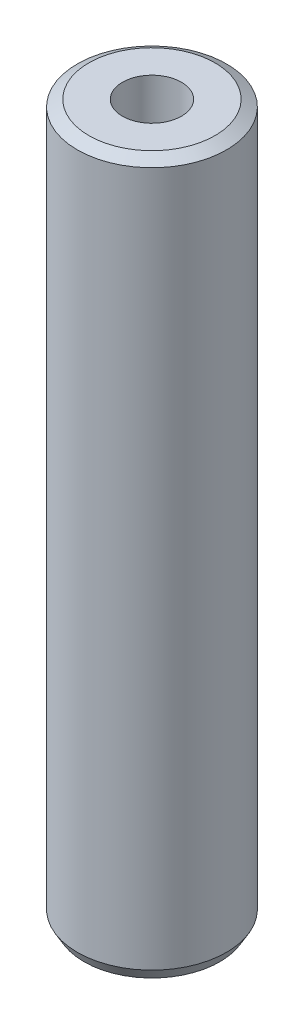
from build123d import *
from OCP.BRepFilletAPI import BRepFilletAPI_MakeChamfer

# Parameters (mm, degrees)
SKETCH1_R           = 50
BOSS_EXTRUDE1_DEPTH = 478.131743215
SKETCH2_R           = 19.774849794
CUT_EXTRUDE1_DEPTH  = 484.33214653
CHAMFER1_SIZE       = 4.447933979
CHAMFER1_SIZE2      = 7.70404764


with BuildPart() as part:
    # Sketch1 → Boss-Extrude1 (new body)
    with BuildSketch(Plane(origin=(0, 0, 0), x_dir=(1, 0, 0), z_dir=(0, 1, 0))):
        Circle(SKETCH1_R)
    extrude(amount=BOSS_EXTRUDE1_DEPTH)

    # Sketch2 → Cut-Extrude1 (cut, through all)
    with BuildSketch(Plane(origin=(0, 0, 0), x_dir=(1, 0, 0), z_dir=(0, 1, 0))):
        Circle(SKETCH2_R)
    extrude(amount=CUT_EXTRUDE1_DEPTH, mode=Mode.SUBTRACT)

    # Chamfer1: one chamfer whose edges measure the first distance from different faces: ONE call of the kernel's chamfer builder (chamfer() names one face for all edges)
    chamfer1_edges_1 = [part.edges().sort_by_distance(p)[0] for p in [
        (-50, 478.131743215, 0),
    ]]
    chamfer1_side_1 = [part.faces().sort_by_distance(p)[0] for p in [
        (-50, 239.065871607, 0),
    ]]
    chamfer1_edges_2 = [part.edges().sort_by_distance(p)[0] for p in [
        (-50, 0, 0),
    ]]
    chamfer1_side_2 = [part.faces().sort_by_distance(p)[0] for p in [
        (-48.585786438, 0, 0),
    ]]
    chamfer1 = BRepFilletAPI_MakeChamfer(part.part.solid().wrapped)
    for e in chamfer1_edges_1:
        chamfer1.Add(CHAMFER1_SIZE, CHAMFER1_SIZE2, e.wrapped, chamfer1_side_1[0].wrapped)  # the first distance lies on this face
    for e in chamfer1_edges_2:
        chamfer1.Add(CHAMFER1_SIZE, CHAMFER1_SIZE2, e.wrapped, chamfer1_side_2[0].wrapped)  # the first distance lies on this face
    add(Compound.cast(chamfer1.Shape()), mode=Mode.REPLACE)


solid = part.part
